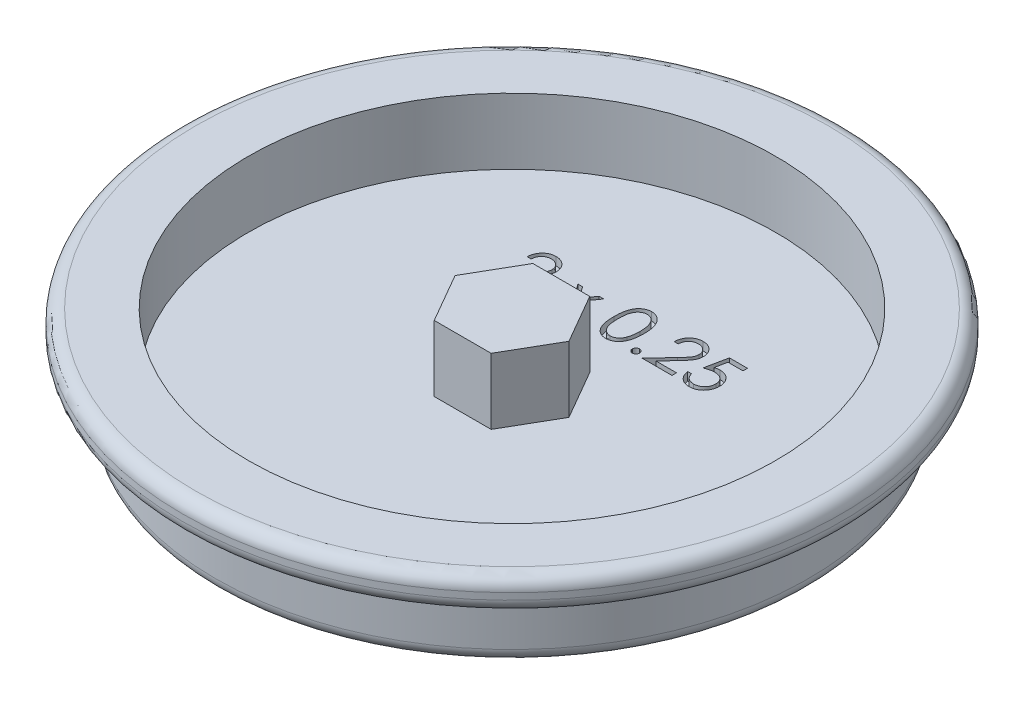
from build123d import *

# Parameters (mm, degrees)
BOSS_EXTRUDE1_DEPTH = 6.35
CUT_EXTRUDE1_DEPTH  = 0.79375


with BuildPart() as part:
    # Sketch1 → Revolve1 (revolve)
    with BuildSketch(Plane.XY):
        with BuildLine():
            Line((0, 0), (27.305, 0))
            ThreePointArc((27.305, 0), (28.203025612, 0.371974388), (28.575, 1.27))
            Line((28.575, 1.27), (28.575, 5.08))
            ThreePointArc((28.575, 5.08), (28.946974388, 5.978025612), (29.845, 6.35))
            Line((29.845, 6.35), (30.48, 6.35))
            ThreePointArc((30.48, 6.35), (31.378025612, 6.721974388), (31.75, 7.62))
            Line((31.75, 7.62), (31.75, 8.255))
            ThreePointArc((31.75, 8.255), (31.378025612, 9.153025612), (30.48, 9.525))
            Line((30.48, 9.525), (25.4, 9.525))
            Line((25.4, 9.525), (25.4, 3.175))
            Line((25.4, 3.175), (0, 3.175))
            Line((0, 3.175), (0, 0))
        make_face()
    revolve(axis=Axis((0, 3.175, 0), (0, -1, 0)))

    # Sketch2 → Boss-Extrude1 (add)
    with BuildSketch(Plane(origin=(0, 3.175, 0), x_dir=(1, 0, 0), z_dir=(0, 1, 0))):
        Polygon((2.742298309, 4.7498), (-2.742298309, 4.7498), (-5.484596617, 0), (-2.742298309, -4.7498), (2.742298309, -4.7498), (5.484596617, 0), align=None)
    extrude(amount=BOSS_EXTRUDE1_DEPTH)

    # Sketch3 → Cut-Extrude1 (cut)
    # profile 1 of 6: a face of its own
    with BuildSketch(Plane(origin=(0, 3.175, 0), x_dir=(1, 0, 0), z_dir=(0, 1, 0))):
        with BuildLine():
            Line((-9.551429239, 11.394866439), (-9.931343769, 11.394866439))
            add(Edge.make_bspline(
                [(-9.931343769, 11.394866439), (-9.928867689, 11.44526837), (-9.924004733, 11.544256421), (-9.901231469, 11.688581527), (-9.868645836, 11.826533522), (-9.822573316, 11.957004751), (-9.765355246, 12.081148832), (-9.696738928, 12.198472661), (-9.615466366, 12.30852867), (-9.523292506, 12.410296604), (-9.423181867, 12.503656809), (-9.315164207, 12.584277912), (-9.201656412, 12.652395476), (-9.083002853, 12.709341359), (-8.957864838, 12.752085744), (-8.827377953, 12.783801442), (-8.690968902, 12.802883308), (-8.598029066, 12.804934401), (-8.550761504, 12.80597755)],
                knots=[0, 0, 0, 0, 1.10065271, 2.161652631, 3.183658789, 4.190468796, 5.17591951, 6.163126047, 7.15150782, 8.156236427, 9.156009102, 10.134482811, 11.092018607, 12.041330605, 13.001268258, 13.972401359, 14.968799086, 16, 16, 16, 16], degree=3))
            add(Edge.make_bspline(
                [(-8.550761504, 12.80597755), (-8.50434231, 12.804890846), (-8.413130251, 12.802755511), (-8.280007624, 12.784417885), (-8.153276992, 12.755697026), (-8.033186074, 12.715401237), (-7.920693024, 12.661233406), (-7.814952771, 12.596164002), (-7.714706457, 12.520907634), (-7.624467775, 12.432305403), (-7.541605622, 12.337717757), (-7.470120038, 12.23673715), (-7.408902211, 12.132440776), (-7.357875208, 12.024033332), (-7.320312069, 11.910494088), (-7.291793665, 11.793476043), (-7.27567384, 11.671767938), (-7.273199852, 11.589391437), (-7.27194206, 11.54751067)],
                knots=[0, 0, 0, 0, 1.111607364, 2.184268762, 3.212621178, 4.221274766, 5.211760367, 6.196651075, 7.1921475, 8.207485113, 9.220403448, 10.201281604, 11.166441695, 12.114753415, 13.065576456, 14.026450734, 14.996634279, 16, 16, 16, 16], degree=3))
            add(Edge.make_bspline(
                [(-7.27194206, 11.54751067), (-7.273990101, 11.488549004), (-7.278050245, 11.371660364), (-7.312780967, 11.199890006), (-7.36702389, 11.03346749), (-7.432334978, 10.899528086), (-7.498220696, 10.791598051), (-7.557593206, 10.702735903), (-7.627098263, 10.607055956), (-7.707747494, 10.504878605), (-7.797872587, 10.39540351), (-7.89828987, 10.278696805), (-8.009715415, 10.155964284), (-8.087921411, 10.072137509), (-8.128445799, 10.028700574)],
                knots=[0, 0, 0, 0, 1.184426356, 2.348067706, 3.509069118, 4.696110526, 5.333549288, 6.050745305, 6.844228056, 7.710549037, 8.667450064, 9.695053472, 10.805634456, 12, 12, 12, 12], degree=3))
            Line((-8.128445799, 10.028700574), (-9.187627156, 8.898285243))
            Line((-9.187627156, 8.898285243), (-7.217668555, 8.898285243))
            Line((-7.217668555, 8.898285243), (-7.217668555, 8.464097209))
            Line((-7.217668555, 8.464097209), (-10.094164282, 8.464097209))
            Line((-10.094164282, 8.464097209), (-8.452390778, 10.216113768))
            add(Edge.make_bspline(
                [(-8.452390778, 10.216113768), (-8.412418572, 10.257840292), (-8.335640145, 10.337988403), (-8.22704598, 10.455001317), (-8.129511204, 10.563555523), (-8.042404453, 10.66344592), (-7.967615356, 10.756133626), (-7.901246085, 10.838616743), (-7.848068656, 10.914519745), (-7.790355748, 11.00250125), (-7.734458838, 11.109921862), (-7.686425797, 11.241195943), (-7.657137362, 11.376332715), (-7.653623894, 11.467654227), (-7.65185659, 11.51358973)],
                knots=[0, 0, 0, 0, 1.329631726, 2.553950428, 3.673215718, 4.687767853, 5.603093632, 6.413772471, 7.123043292, 7.734684054, 8.834405432, 9.900288307, 10.943827018, 12, 12, 12, 12], degree=3))
            add(Edge.make_bspline(
                [(-7.65185659, 11.51358973), (-7.652625535, 11.54247485), (-7.654140979, 11.599401875), (-7.667515527, 11.682865983), (-7.687727282, 11.76337771), (-7.716689642, 11.841184707), (-7.754918747, 11.915504686), (-7.801453216, 11.986428114), (-7.855144054, 12.054994768), (-7.917254637, 12.119284947), (-7.985485713, 12.178166024), (-8.057566377, 12.230325632), (-8.13382698, 12.273915795), (-8.213945984, 12.309649358), (-8.297700028, 12.337680534), (-8.385251101, 12.357103768), (-8.476357292, 12.369298772), (-8.53856733, 12.37094877), (-8.570266045, 12.371789516)],
                knots=[0, 0, 0, 0, 0.991446411, 1.95395049, 2.89581595, 3.838931463, 4.798493298, 5.75982156, 6.748411868, 7.785213223, 8.824556874, 9.840280684, 10.836137867, 11.835679398, 12.848801643, 13.863922112, 14.911575587, 16, 16, 16, 16], degree=3))
            add(Edge.make_bspline(
                [(-8.570266045, 12.371789516), (-8.603371719, 12.370924668), (-8.668385796, 12.369226248), (-8.763840245, 12.357345502), (-8.854900186, 12.336849105), (-8.941794678, 12.308816365), (-9.024670748, 12.273185549), (-9.103125354, 12.22880601), (-9.176982372, 12.175848833), (-9.246380643, 12.115807398), (-9.310320885, 12.048959918), (-9.366499487, 11.974441201), (-9.415586818, 11.893611851), (-9.458415129, 11.806689966), (-9.493195821, 11.712886823), (-9.51977287, 11.612535408), (-9.540802675, 11.506071452), (-9.547828219, 11.432550444), (-9.551429239, 11.394866439)],
                knots=[0, 0, 0, 0, 1.031018746, 2.02475058, 2.990194455, 3.934040569, 4.864654155, 5.795059489, 6.735614925, 7.690564532, 8.649604399, 9.611025574, 10.590972636, 11.591080095, 12.624614302, 13.701020113, 14.821632451, 16, 16, 16, 16], degree=3))
        make_face()
    # profile 2 of 6: a face of its own
    with BuildSketch(Plane(origin=(0, 3.175, 0), x_dir=(1, 0, 0), z_dir=(0, 1, 0))):
        Polygon((-5.209548897, 11.557686952), (-4.757552369, 11.557686952), (-3.961258299, 10.441688021), (-3.164964228, 11.557686952), (-2.712967701, 11.557686952), (-3.734836023, 10.125375253), (-2.550147188, 8.464097209), (-3.002143716, 8.464097209), (-3.961258299, 9.808214463), (-4.920372882, 8.464097209), (-5.37236941, 8.464097209), (-4.186832551, 10.125375253), align=None)
    # profile 3 of 6: a face of its own
    with BuildSketch(Plane(origin=(0, 3.175, 0), x_dir=(1, 0, 0), z_dir=(0, 1, 0))):
        with BuildLine():
            add(Edge.make_bspline(
                [(-0.759121547, 10.579067828), (-0.758724801, 10.646918954), (-0.757954117, 10.778720745), (-0.749380503, 10.97077455), (-0.735137946, 11.150945566), (-0.715619409, 11.319242418), (-0.691866804, 11.475708552), (-0.660158549, 11.619925829), (-0.624099255, 11.752561735), (-0.582307249, 11.874048784), (-0.53515059, 11.98602372), (-0.483825341, 12.090557058), (-0.42629459, 12.187490634), (-0.365846324, 12.27837158), (-0.300033627, 12.36171224), (-0.230729376, 12.438689555), (-0.15522863, 12.507524463), (-0.076097944, 12.5702338), (0.007379113, 12.625206018), (0.092823099, 12.673626569), (0.180822132, 12.714992123), (0.271616468, 12.747516745), (0.364390038, 12.774381293), (0.459467156, 12.792752687), (0.557004806, 12.804311995), (0.622840922, 12.805417098), (0.656229682, 12.80597755)],
                knots=[0, 0, 0, 0, 1.646270934, 3.197905019, 4.663502075, 6.030701355, 7.308322542, 8.50163776, 9.611534131, 10.641858119, 11.616356847, 12.558055219, 13.465016945, 14.349605745, 15.204443733, 16.039544428, 16.859896111, 17.680448484, 18.487036065, 19.28249412, 20.06191084, 20.843045899, 21.620316918, 22.403196591, 23.190181807, 24, 24, 24, 24], degree=3))
            add(Edge.make_bspline(
                [(0.656229682, 12.80597755), (0.689897356, 12.805387526), (0.756851767, 12.804214154), (0.855839649, 12.792936624), (0.952540693, 12.774223932), (1.046542632, 12.747709991), (1.138617615, 12.714816173), (1.228045461, 12.673586993), (1.315381645, 12.625594458), (1.399238279, 12.569201769), (1.480535956, 12.506327968), (1.557277778, 12.435253121), (1.62947073, 12.356694889), (1.698020861, 12.271493777), (1.760983345, 12.178015627), (1.820943592, 12.077886275), (1.874612626, 11.969354658), (1.926301233, 11.854231616), (1.970916922, 11.729331762), (2.011153237, 11.595359147), (2.04366399, 11.450731321), (2.070744348, 11.2962071), (2.091723412, 11.131219001), (2.107002894, 10.956120696), (2.115074149, 10.770796985), (2.116594159, 10.644089873), (2.11737418, 10.579067828)],
                knots=[0, 0, 0, 0, 0.810914788, 1.612654377, 2.396697861, 3.181598691, 3.963628158, 4.749916497, 5.551656086, 6.361998678, 7.18212741, 8.025565596, 8.878627764, 9.750805457, 10.657531673, 11.591944965, 12.560506719, 13.57287815, 14.630710178, 15.753379473, 16.941251878, 18.199788006, 19.531962791, 20.947069417, 22.433333509, 24, 24, 24, 24], degree=3))
            add(Edge.make_bspline(
                [(2.11737418, 10.579067828), (2.116586073, 10.514329387), (2.115050478, 10.388189175), (2.107093376, 10.203699329), (2.091419603, 10.029530267), (2.071813236, 9.865264279), (2.044658262, 9.711585064), (2.011269156, 9.567960826), (1.974196861, 9.43377133), (1.928434776, 9.310115891), (1.878347536, 9.195269521), (1.823852204, 9.088024494), (1.7654687, 8.987432883), (1.701861361, 8.894299856), (1.634063423, 8.807965671), (1.560623812, 8.729954261), (1.483612723, 8.658385924), (1.402075801, 8.594702527), (1.316911353, 8.538961858), (1.229875136, 8.489112725), (1.139422854, 8.448916989), (1.04760433, 8.414403178), (0.953106211, 8.388035012), (0.856046291, 8.369802825), (0.756918272, 8.357015923), (0.68990876, 8.356040466), (0.656229682, 8.3555502)],
                knots=[0, 0, 0, 0, 1.561518951, 3.042555995, 4.452378317, 5.7783523, 7.031515105, 8.214008947, 9.334062868, 10.386615937, 11.391082383, 12.354592575, 13.286541444, 14.194233754, 15.072674879, 15.931287219, 16.775624067, 17.606195743, 18.42308326, 19.229000347, 20.022332153, 20.807536673, 21.593273796, 22.3848459, 23.188221202, 24, 24, 24, 24], degree=3))
            add(Edge.make_bspline(
                [(0.656229682, 8.3555502), (0.622841849, 8.356114268), (0.557007559, 8.3572265), (0.45945653, 8.368733585), (0.364772051, 8.38723386), (0.272486891, 8.413137753), (0.182127582, 8.444845221), (0.094925407, 8.486154915), (0.00991078, 8.533730408), (-0.072689483, 8.587911537), (-0.15132324, 8.649986334), (-0.226432981, 8.718644093), (-0.296131814, 8.795598124), (-0.361003529, 8.879633326), (-0.422657903, 8.969976581), (-0.479371716, 9.067861375), (-0.531829797, 9.17289958), (-0.579779543, 9.285769815), (-0.622292688, 9.408119109), (-0.65984563, 9.541347163), (-0.689496087, 9.686629885), (-0.714875472, 9.842800414), (-0.735345916, 10.010529835), (-0.749321147, 10.189909205), (-0.757958738, 10.380826743), (-0.758726871, 10.511781613), (-0.759121547, 10.579067828)],
                knots=[0, 0, 0, 0, 0.810891512, 1.598919785, 2.382837074, 3.152667961, 3.926044502, 4.706494248, 5.493654104, 6.291793342, 7.103789334, 7.925228297, 8.761435821, 9.622817696, 10.50288917, 11.416980706, 12.369136599, 13.353924996, 14.394355917, 15.514179734, 16.714354668, 17.994756427, 19.357759367, 20.818452758, 22.365282078, 24, 24, 24, 24], degree=3))
        make_face()
        with BuildLine():
            add(Edge.make_bspline(
                [(-0.379207017, 10.580763875), (-0.379062543, 10.524220211), (-0.378782147, 10.414480062), (-0.371457028, 10.255012498), (-0.361478176, 10.106276958), (-0.348607274, 9.968084585), (-0.329493231, 9.840903141), (-0.30807645, 9.723857906), (-0.282013522, 9.617568295), (-0.251176691, 9.521304943), (-0.216053212, 9.433434165), (-0.177704215, 9.351668886), (-0.13650696, 9.27504321), (-0.09040094, 9.204245417), (-0.040187482, 9.139044628), (0.012999222, 9.078286822), (0.071144157, 9.024103806), (0.151582017, 8.959119896), (0.257773943, 8.891968182), (0.391572018, 8.833492435), (0.529056715, 8.79674413), (0.622372989, 8.792070826), (0.668950034, 8.789738234)],
                knots=[0, 0, 0, 0, 1.459021318, 2.831673884, 4.118529203, 5.306027144, 6.411944654, 7.436330062, 8.375795394, 9.233974572, 10.042671642, 10.816086306, 11.563610507, 12.285937304, 12.993564865, 13.685989202, 14.367179055, 15.041617293, 16.353048772, 17.594441528, 18.799311195, 20, 20, 20, 20], degree=3))
            add(Edge.make_bspline(
                [(0.668950034, 8.789738234), (0.715828361, 8.791670788), (0.809488228, 8.795531906), (0.946326247, 8.832783712), (1.079168574, 8.888989727), (1.183274635, 8.955450043), (1.26247733, 9.018742403), (1.319224547, 9.072704882), (1.37130912, 9.133127693), (1.420708582, 9.198320175), (1.466016226, 9.269527846), (1.507216402, 9.346408295), (1.544812451, 9.429175015), (1.566231963, 9.486953651), (1.577183207, 9.516494377)],
                knots=[0, 0, 0, 0, 1.353760809, 2.704726607, 4.075137775, 5.516104923, 6.260822281, 7.007110065, 7.778089737, 8.566572457, 9.372053459, 10.217411131, 11.088608312, 12, 12, 12, 12], degree=3))
            add(Edge.make_bspline(
                [(1.577183207, 9.516494377), (1.589945822, 9.554267491), (1.615859402, 9.63096311), (1.649256501, 9.74993629), (1.675558079, 9.87476249), (1.699220436, 10.004695726), (1.715371275, 10.140694222), (1.728371011, 10.282337181), (1.736028127, 10.4297314), (1.736977302, 10.529873914), (1.73745965, 10.580763875)],
                knots=[0, 0, 0, 0, 0.884706709, 1.796334032, 2.740027952, 3.714592787, 4.726048262, 5.777819803, 6.87074269, 8, 8, 8, 8], degree=3))
            add(Edge.make_bspline(
                [(1.73745965, 10.580763875), (1.736794183, 10.631645606), (1.735492387, 10.731181148), (1.730516421, 10.876950757), (1.717666955, 11.015402239), (1.70339564, 11.147132049), (1.682353286, 11.271410987), (1.659665272, 11.389279451), (1.629183806, 11.499277205), (1.596623697, 11.603126413), (1.55935779, 11.699647205), (1.518335902, 11.789289594), (1.474524823, 11.872486356), (1.426939446, 11.949009229), (1.376144668, 12.019200971), (1.320799822, 12.081654242), (1.263100248, 12.138304671), (1.18228327, 12.202968921), (1.076481034, 12.268902114), (0.944829632, 12.329578795), (0.807826091, 12.364423111), (0.715208675, 12.369335818), (0.668950034, 12.371789516)],
                knots=[0, 0, 0, 0, 1.31362396, 2.569729283, 3.763502607, 4.902122613, 5.988968491, 7.01645872, 7.998833611, 8.933434873, 9.825090667, 10.667526885, 11.477055099, 12.250526234, 12.991942729, 13.710640831, 14.402115721, 15.076753259, 16.378508321, 17.609869233, 18.806226677, 20, 20, 20, 20], degree=3))
            add(Edge.make_bspline(
                [(0.668950034, 12.371789516), (0.622128652, 12.369332433), (0.528400589, 12.364413791), (0.389973062, 12.329708617), (0.257283037, 12.269216744), (0.151760582, 12.202750541), (0.07088724, 12.139446108), (0.013939602, 12.084550111), (-0.039456245, 12.024501784), (-0.088644796, 11.958701373), (-0.134714691, 11.887986119), (-0.177025059, 11.811799708), (-0.21514602, 11.729756058), (-0.250324459, 11.641924751), (-0.281255355, 11.545669704), (-0.306769005, 11.439511016), (-0.33033906, 11.322838061), (-0.347024766, 11.194967799), (-0.361858071, 11.056740814), (-0.371390749, 10.907633962), (-0.378806651, 10.74789895), (-0.379070889, 10.637591396), (-0.379207017, 10.580763875)],
                knots=[0, 0, 0, 0, 1.207732386, 2.417664972, 3.655092373, 4.956220595, 5.625982001, 6.301752483, 6.994047911, 7.697131622, 8.419323945, 9.170223765, 9.943494443, 10.752040957, 11.610060368, 12.549350801, 13.567764191, 14.679664412, 15.874934091, 17.154273443, 18.533957287, 20, 20, 20, 20], degree=3))
        make_face(mode=Mode.SUBTRACT)
    # profile 4 of 6: a face of its own
    with BuildSketch(Plane(origin=(0, 3.175, 0), x_dir=(1, 0, 0), z_dir=(0, 1, 0))):
        with BuildLine():
            add(Edge.make_bspline(
                [(3.175707513, 9.11537926), (3.199281389, 9.11397843), (3.245495216, 9.111232266), (3.312308257, 9.092391908), (3.372777988, 9.0589381), (3.426640799, 9.014351692), (3.471038156, 8.960291223), (3.505684182, 8.90030379), (3.524360421, 8.832931388), (3.527086581, 8.786449781), (3.528485291, 8.762601482)],
                knots=[0, 0, 0, 0, 1.020151414, 1.999887582, 2.974338812, 3.990962822, 5.007586832, 5.987933904, 6.967670073, 8, 8, 8, 8], degree=3))
            add(Edge.make_bspline(
                [(3.528485291, 8.762601482), (3.527039183, 8.739326217), (3.52418748, 8.693427735), (3.505726992, 8.62656349), (3.470774113, 8.566538567), (3.426947026, 8.511744552), (3.372764673, 8.46706369), (3.312165297, 8.433894501), (3.245652061, 8.413705154), (3.199307555, 8.411133347), (3.175707513, 8.409823704)],
                knots=[0, 0, 0, 0, 1.009421747, 1.99056486, 2.972319754, 3.999869655, 5.017953583, 5.993804169, 6.978383603, 8, 8, 8, 8], degree=3))
            add(Edge.make_bspline(
                [(3.175707513, 8.409823704), (3.152090465, 8.41108596), (3.105983802, 8.413550214), (3.039718837, 8.434309036), (2.978750408, 8.46675265), (2.924578605, 8.511827865), (2.880384453, 8.566256609), (2.846970895, 8.626976877), (2.826904715, 8.69323633), (2.824265688, 8.739288517), (2.822929735, 8.762601482)],
                knots=[0, 0, 0, 0, 1.022052826, 1.995314843, 2.982371812, 4.00089066, 5.028879526, 6.005146991, 6.990147033, 8, 8, 8, 8], degree=3))
            add(Edge.make_bspline(
                [(2.822929735, 8.762601482), (2.82421437, 8.786488827), (2.82672246, 8.833125936), (2.847013021, 8.899890571), (2.880125201, 8.960570493), (2.924884107, 9.014269214), (2.978737303, 9.059248142), (3.039571761, 9.091983653), (3.106143396, 9.111384914), (3.152117321, 9.11402472), (3.175707513, 9.11537926)],
                knots=[0, 0, 0, 0, 1.032775665, 2.016367738, 2.991239715, 4.008302682, 5.025365648, 6.011011707, 6.979408107, 8, 8, 8, 8], degree=3))
        make_face()
    # profile 5 of 6: a face of its own
    with BuildSketch(Plane(origin=(0, 3.175, 0), x_dir=(1, 0, 0), z_dir=(0, 1, 0))):
        with BuildLine():
            Line((4.613955376, 11.394866439), (4.234040846, 11.394866439))
            add(Edge.make_bspline(
                [(4.234040846, 11.394866439), (4.236516927, 11.44526837), (4.241379883, 11.544256421), (4.264153147, 11.688581527), (4.296738779, 11.826533522), (4.3428113, 11.957004751), (4.400029369, 12.081148832), (4.468645688, 12.198472661), (4.54991825, 12.30852867), (4.642092109, 12.410296604), (4.742202749, 12.503656809), (4.850220409, 12.584277912), (4.963728204, 12.652395476), (5.082381763, 12.709341359), (5.207519777, 12.752085744), (5.338006663, 12.783801442), (5.474415713, 12.802883308), (5.56735555, 12.804934401), (5.614623111, 12.80597755)],
                knots=[0, 0, 0, 0, 1.10065271, 2.161652631, 3.183658789, 4.190468796, 5.17591951, 6.163126047, 7.15150782, 8.156236427, 9.156009102, 10.134482811, 11.092018607, 12.041330605, 13.001268258, 13.972401359, 14.968799086, 16, 16, 16, 16], degree=3))
            add(Edge.make_bspline(
                [(5.614623111, 12.80597755), (5.661042306, 12.804890846), (5.752254364, 12.802755511), (5.885376991, 12.784417885), (6.012107624, 12.755697026), (6.132198541, 12.715401237), (6.244691591, 12.661233406), (6.350431845, 12.596164002), (6.450678159, 12.520907634), (6.54091684, 12.432305403), (6.623778993, 12.337717757), (6.695264578, 12.23673715), (6.756482404, 12.132440776), (6.807509407, 12.024033332), (6.845072547, 11.910494088), (6.873590951, 11.793476043), (6.889710775, 11.671767938), (6.892184763, 11.589391437), (6.893442556, 11.54751067)],
                knots=[0, 0, 0, 0, 1.111607364, 2.184268762, 3.212621178, 4.221274766, 5.211760367, 6.196651075, 7.1921475, 8.207485113, 9.220403448, 10.201281604, 11.166441695, 12.114753415, 13.065576456, 14.026450734, 14.996634279, 16, 16, 16, 16], degree=3))
            add(Edge.make_bspline(
                [(6.893442556, 11.54751067), (6.891394514, 11.488549004), (6.887334371, 11.371660364), (6.852603649, 11.199890006), (6.798360726, 11.03346749), (6.733049637, 10.899528086), (6.667163919, 10.791598051), (6.60779141, 10.702735903), (6.538286353, 10.607055956), (6.457637122, 10.504878605), (6.367512029, 10.39540351), (6.267094745, 10.278696805), (6.155669201, 10.155964284), (6.077463204, 10.072137509), (6.036938816, 10.028700574)],
                knots=[0, 0, 0, 0, 1.184426356, 2.348067706, 3.509069118, 4.696110526, 5.333549288, 6.050745305, 6.844228056, 7.710549037, 8.667450064, 9.695053472, 10.805634456, 12, 12, 12, 12], degree=3))
            Line((6.036938816, 10.028700574), (4.97775746, 8.898285243))
            Line((4.97775746, 8.898285243), (6.94771606, 8.898285243))
            Line((6.94771606, 8.898285243), (6.94771606, 8.464097209))
            Line((6.94771606, 8.464097209), (4.071220334, 8.464097209))
            Line((4.071220334, 8.464097209), (5.712993838, 10.216113768))
            add(Edge.make_bspline(
                [(5.712993838, 10.216113768), (5.752966044, 10.257840292), (5.829744471, 10.337988403), (5.938338635, 10.455001317), (6.035873412, 10.563555523), (6.122980163, 10.66344592), (6.19776926, 10.756133626), (6.264138531, 10.838616743), (6.31731596, 10.914519745), (6.375028867, 11.00250125), (6.430925778, 11.109921862), (6.478958818, 11.241195943), (6.508247254, 11.376332715), (6.511760721, 11.467654227), (6.513528026, 11.51358973)],
                knots=[0, 0, 0, 0, 1.329631726, 2.553950428, 3.673215718, 4.687767853, 5.603093632, 6.413772471, 7.123043292, 7.734684054, 8.834405432, 9.900288307, 10.943827018, 12, 12, 12, 12], degree=3))
            add(Edge.make_bspline(
                [(6.513528026, 11.51358973), (6.51275908, 11.54247485), (6.511243637, 11.599401875), (6.497869088, 11.682865983), (6.477657333, 11.76337771), (6.448694973, 11.841184707), (6.410465869, 11.915504686), (6.3639314, 11.986428114), (6.310240561, 12.054994768), (6.248129978, 12.119284947), (6.179898902, 12.178166024), (6.107818238, 12.230325632), (6.031557636, 12.273915795), (5.951438631, 12.309649358), (5.867684587, 12.337680534), (5.780133514, 12.357103768), (5.689027323, 12.369298772), (5.626817286, 12.37094877), (5.595118571, 12.371789516)],
                knots=[0, 0, 0, 0, 0.991446411, 1.95395049, 2.89581595, 3.838931463, 4.798493298, 5.75982156, 6.748411868, 7.785213223, 8.824556874, 9.840280684, 10.836137867, 11.835679398, 12.848801643, 13.863922112, 14.911575587, 16, 16, 16, 16], degree=3))
            add(Edge.make_bspline(
                [(5.595118571, 12.371789516), (5.562012897, 12.370924668), (5.49699882, 12.369226248), (5.40154437, 12.357345502), (5.31048443, 12.336849105), (5.223589938, 12.308816365), (5.140713867, 12.273185549), (5.062259261, 12.22880601), (4.988402243, 12.175848833), (4.919003972, 12.115807398), (4.855063731, 12.048959918), (4.798885128, 11.974441201), (4.749797797, 11.893611851), (4.706969486, 11.806689966), (4.672188794, 11.712886823), (4.645611746, 11.612535408), (4.62458194, 11.506071452), (4.617556397, 11.432550444), (4.613955376, 11.394866439)],
                knots=[0, 0, 0, 0, 1.031018746, 2.02475058, 2.990194455, 3.934040569, 4.864654155, 5.795059489, 6.735614925, 7.690564532, 8.649604399, 9.611025574, 10.590972636, 11.591080095, 12.624614302, 13.701020113, 14.821632451, 16, 16, 16, 16], degree=3))
        make_face()
    # profile 6 of 6: a face of its own
    with BuildSketch(Plane(origin=(0, 3.175, 0), x_dir=(1, 0, 0), z_dir=(0, 1, 0))):
        with BuildLine():
            Line((9.987032299, 12.697430542), (9.987032299, 12.263242508))
            Line((9.987032299, 12.263242508), (8.547088389, 12.263242508))
            Line((8.547088389, 12.263242508), (8.318970066, 11.149787647))
            add(Edge.make_bspline(
                [(8.318970066, 11.149787647), (8.363790029, 11.162161404), (8.450621617, 11.186133602), (8.578782592, 11.212750105), (8.700451257, 11.228794975), (8.779403372, 11.230985799), (8.817607887, 11.232045927)],
                knots=[0, 0, 0, 0, 1.100273476, 2.13160584, 3.095893838, 4, 4, 4, 4], degree=3))
            add(Edge.make_bspline(
                [(8.817607887, 11.232045927), (8.864880601, 11.231022747), (8.957830567, 11.229010921), (9.093828151, 11.209692589), (9.22364984, 11.179285263), (9.347024136, 11.136806156), (9.464179278, 11.082486765), (9.574037376, 11.014632551), (9.678247423, 10.935368427), (9.774939894, 10.844236841), (9.862659772, 10.743941171), (9.939786254, 10.636102603), (10.005297197, 10.521769145), (10.057984967, 10.399848409), (10.100057448, 10.27168829), (10.128060337, 10.135940309), (10.146707213, 9.993884012), (10.14879048, 9.896753722), (10.149852812, 9.847223544)],
                knots=[0, 0, 0, 0, 1.052922333, 2.070308379, 3.05430497, 4.020497103, 4.973039431, 5.925935799, 6.892292201, 7.88610001, 8.88166317, 9.857072816, 10.836096531, 11.812156883, 12.81219415, 13.836441305, 14.89672472, 16, 16, 16, 16], degree=3))
            add(Edge.make_bspline(
                [(10.149852812, 9.847223544), (10.149048388, 9.812725239), (10.14745041, 9.744194845), (10.139324118, 9.642420431), (10.123678062, 9.542800623), (10.102671386, 9.445322206), (10.075405795, 9.350169728), (10.042399034, 9.257070832), (10.002005744, 9.166604974), (9.957699223, 9.077916163), (9.907810626, 8.993009397), (9.852440432, 8.913605385), (9.793941218, 8.838512968), (9.730995924, 8.768537501), (9.663019482, 8.704138803), (9.590835141, 8.644934691), (9.5150189, 8.589923939), (9.434397797, 8.541339551), (9.350768318, 8.496631975), (9.26292276, 8.459954935), (9.17286077, 8.427164106), (9.079286111, 8.401026867), (8.982410738, 8.38054654), (8.882074961, 8.366636289), (8.778805008, 8.356504789), (8.708803802, 8.355870567), (8.673443891, 8.3555502)],
                knots=[0, 0, 0, 0, 1.056347294, 2.098418968, 3.122841568, 4.141288669, 5.149314143, 6.15115421, 7.162517403, 8.180376062, 9.185164535, 10.17417709, 11.141909838, 12.097768115, 13.052685741, 14.0056014, 14.954263652, 15.917497458, 16.885230207, 17.854509472, 18.828990115, 19.81800267, 20.826176721, 21.857883937, 22.917946725, 24, 24, 24, 24], degree=3))
            add(Edge.make_bspline(
                [(8.673443891, 8.3555502), (8.631262739, 8.356385785), (8.548276306, 8.3580297), (8.426694287, 8.375227296), (8.309715668, 8.399857938), (8.198282118, 8.436913236), (8.09139497, 8.483343583), (7.990493207, 8.542025047), (7.892998601, 8.608523582), (7.802874519, 8.686997914), (7.719228553, 8.77277212), (7.644351157, 8.865854219), (7.577665783, 8.964707925), (7.520240317, 9.069813312), (7.471256996, 9.180894201), (7.43277601, 9.298366783), (7.401717429, 9.421617264), (7.388577863, 9.506469606), (7.381904094, 9.549567294)],
                knots=[0, 0, 0, 0, 1.0467383, 2.05933395, 3.04377827, 4.011590433, 4.970194871, 5.932262533, 6.905835911, 7.896367577, 8.894135286, 9.877477877, 10.858688626, 11.851381753, 12.8477658, 13.868841284, 14.917554742, 16, 16, 16, 16], degree=3))
            Line((7.381904094, 9.549567294), (7.761818624, 9.549567294))
            add(Edge.make_bspline(
                [(7.761818624, 9.549567294), (7.771166498, 9.50919768), (7.789133632, 9.431605041), (7.828571061, 9.322589037), (7.876789787, 9.225441024), (7.934126475, 9.138875909), (8.002525083, 9.063390741), (8.080574964, 8.99612058), (8.168081257, 8.935432567), (8.265318783, 8.884846934), (8.367902221, 8.841704727), (8.475268275, 8.812976487), (8.584493533, 8.792776359), (8.658369276, 8.790754325), (8.695492502, 8.789738234)],
                knots=[0, 0, 0, 0, 1.136247022, 2.183929868, 3.172523383, 4.106158343, 5.02341133, 5.958108904, 6.928429099, 7.938127109, 8.96079061, 9.975095812, 10.982467395, 12, 12, 12, 12], degree=3))
            add(Edge.make_bspline(
                [(8.695492502, 8.789738234), (8.731727954, 8.790730985), (8.803075855, 8.792685718), (8.908076294, 8.807731), (9.009449961, 8.830902538), (9.106196574, 8.86557941), (9.200009103, 8.907724927), (9.28851452, 8.961808876), (9.374273238, 9.024050993), (9.454619647, 9.095360441), (9.52820641, 9.173942834), (9.593225718, 9.257977395), (9.647384461, 9.347623486), (9.693024764, 9.441329109), (9.727681611, 9.540121269), (9.752405465, 9.643536976), (9.76692345, 9.751831666), (9.768920592, 9.82569645), (9.769938282, 9.863335991)],
                knots=[0, 0, 0, 0, 1.027316725, 2.022795036, 3.002884548, 3.971462791, 4.93288096, 5.914575861, 6.907176829, 7.935150275, 8.956128384, 9.956726525, 10.942570165, 11.921478529, 12.907843606, 13.90538589, 14.932640048, 16, 16, 16, 16], degree=3))
            add(Edge.make_bspline(
                [(9.769938282, 9.863335991), (9.769141836, 9.897294281), (9.767582905, 9.963762802), (9.754845929, 10.061007556), (9.732691115, 10.153019712), (9.701940327, 10.240243595), (9.662897494, 10.322761473), (9.61518624, 10.400658508), (9.557911178, 10.472908001), (9.49248575, 10.539543757), (9.420811739, 10.601041843), (9.341655974, 10.653467548), (9.25667492, 10.697571524), (9.166892452, 10.735632818), (9.070173003, 10.762968957), (8.968431934, 10.783492019), (8.860570582, 10.795363934), (8.786825083, 10.79701117), (8.748917983, 10.797857892)],
                knots=[0, 0, 0, 0, 1.045622112, 2.046656509, 3.013763289, 3.955457236, 4.890082067, 5.820317437, 6.762574623, 7.722996705, 8.69280354, 9.665887285, 10.63943826, 11.638615906, 12.663482002, 13.728887084, 14.832589034, 16, 16, 16, 16], degree=3))
            add(Edge.make_bspline(
                [(8.748917983, 10.797857892), (8.716104898, 10.797155654), (8.648354201, 10.795705708), (8.544428497, 10.78502985), (8.435218508, 10.767807085), (8.32114288, 10.744117052), (8.201859027, 10.713115655), (8.077618676, 10.675965735), (7.948160601, 10.631549603), (7.860932496, 10.59800683), (7.816092128, 10.580763875)],
                knots=[0, 0, 0, 0, 0.817624296, 1.688186739, 2.600797293, 3.572016777, 4.590301741, 5.671205678, 6.80286297, 8, 8, 8, 8], degree=3))
            Line((7.816092128, 10.580763875), (8.250280163, 12.697430542))
            Line((8.250280163, 12.697430542), (9.987032299, 12.697430542))
        make_face()
    extrude(amount=-CUT_EXTRUDE1_DEPTH, mode=Mode.SUBTRACT)


solid = part.part
